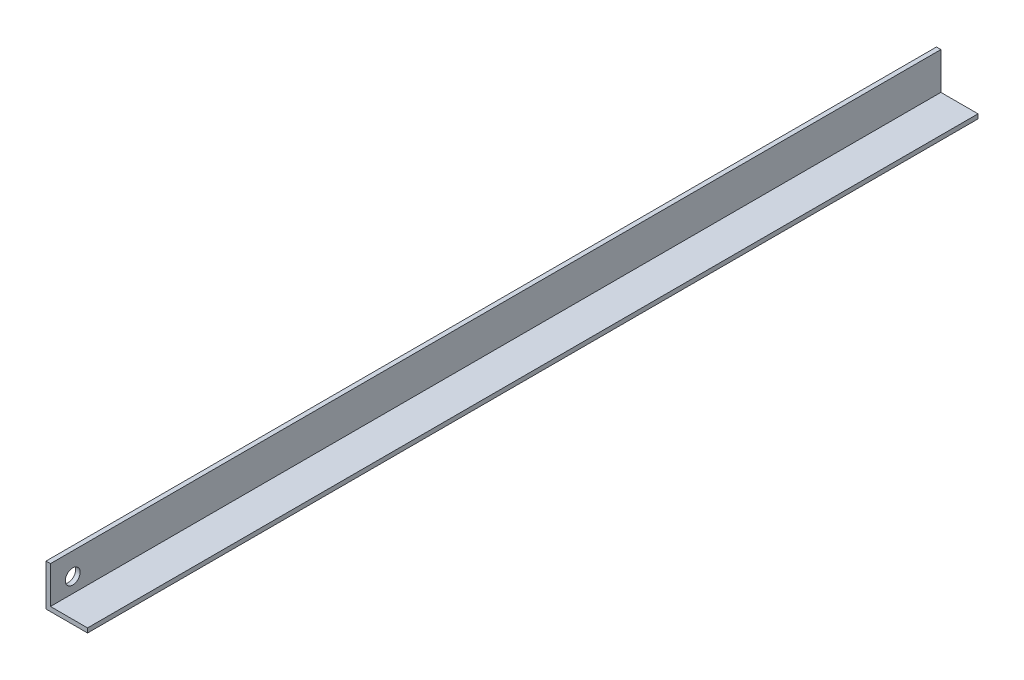
from build123d import *

# Parameters (mm, degrees)
EXTRUDE_1_DEPTH     = 600
SKETCH_2_R          = 5
CUT_EXTRUDE_3_DEPTH = 10


with BuildPart() as part:
    # Эскиз1 → Вытянуть-Тонкостенный1 (new body)
    with BuildSketch(Plane.XY):
        Polygon((0, 25), (0, 0), (25, 0), (25, -3), (-3, -3), (-3, 25), align=None)
    extrude(amount=EXTRUDE_1_DEPTH)

    # Эскиз2 → Вырез-Вытянуть3 (cut)
    with BuildSketch(Plane.YZ.offset(-3)):
        with Locations((10, 585)):
            Circle(SKETCH_2_R)
    extrude(amount=CUT_EXTRUDE_3_DEPTH, mode=Mode.SUBTRACT)


solid = part.part
